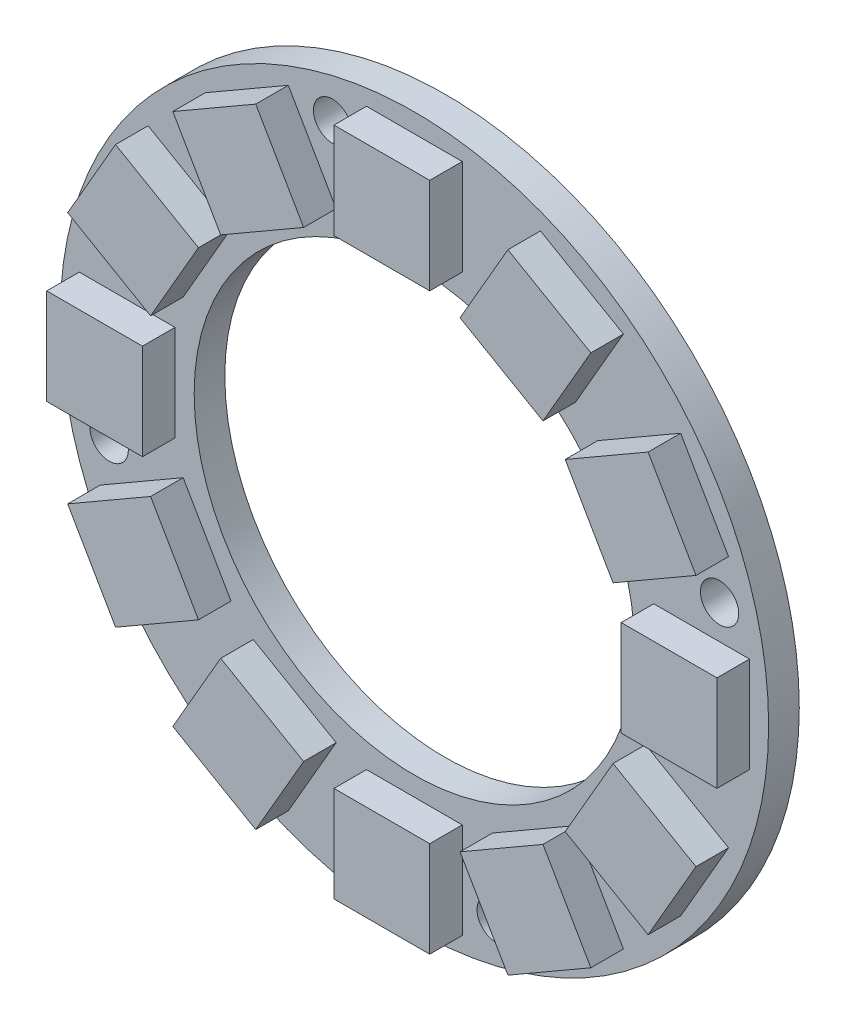
from build123d import *

# Parameters (mm, degrees)
SKETCH1_R           = 18.5
SKETCH1_R_2         = 11.5
BOSS_EXTRUDE1_DEPTH = 1.6
SKETCH2_W           = 5
SKETCH2_H           = 5
BOSS_EXTRUDE2_DEPTH = 1.7
CIRPATTERN1_COUNT   = 12
SKETCH3_R           = 1
CUT_EXTRUDE1_DEPTH  = 2
CIRPATTERN2_COUNT   = 4


with BuildPart() as part:
    # Sketch1 → Boss-Extrude1 (new body)
    with BuildSketch(Plane.XY):
        Circle(SKETCH1_R)
        Circle(SKETCH1_R_2, mode=Mode.SUBTRACT)
    extrude(amount=BOSS_EXTRUDE1_DEPTH)

    # Sketch2 → Boss-Extrude2 (add)
    with BuildSketch(Plane.XY.offset(1.6)):
        with Locations((0, 15)):
            Rectangle(SKETCH2_W, SKETCH2_H)
    boss_extrude2 = extrude(amount=BOSS_EXTRUDE2_DEPTH)

    # CirPattern1: Boss-Extrude2 ×12 about axis
    cirpattern1_axis = Axis((0, 0, 1.6), (0, 0, -1))
    for i in range(1, CIRPATTERN1_COUNT):
        add(boss_extrude2.rotate(cirpattern1_axis, i * 360 / CIRPATTERN1_COUNT))

    # Sketch3 → Cut-Extrude1 (cut)
    with BuildSketch(Plane.XY.offset(1.6)):
        with Locations((-4.270514244, 15.937776134)):
            Circle(SKETCH3_R)
    cut_extrude1 = extrude(amount=-CUT_EXTRUDE1_DEPTH, mode=Mode.SUBTRACT)

    # CirPattern2: Cut-Extrude1 ×4 about axis
    cirpattern2_axis = Axis((0, 0, 1.6), (0, 0, -1))
    for i in range(1, CIRPATTERN2_COUNT):
        add(cut_extrude1.rotate(cirpattern2_axis, i * 360 / CIRPATTERN2_COUNT), mode=Mode.SUBTRACT)


solid = part.part
